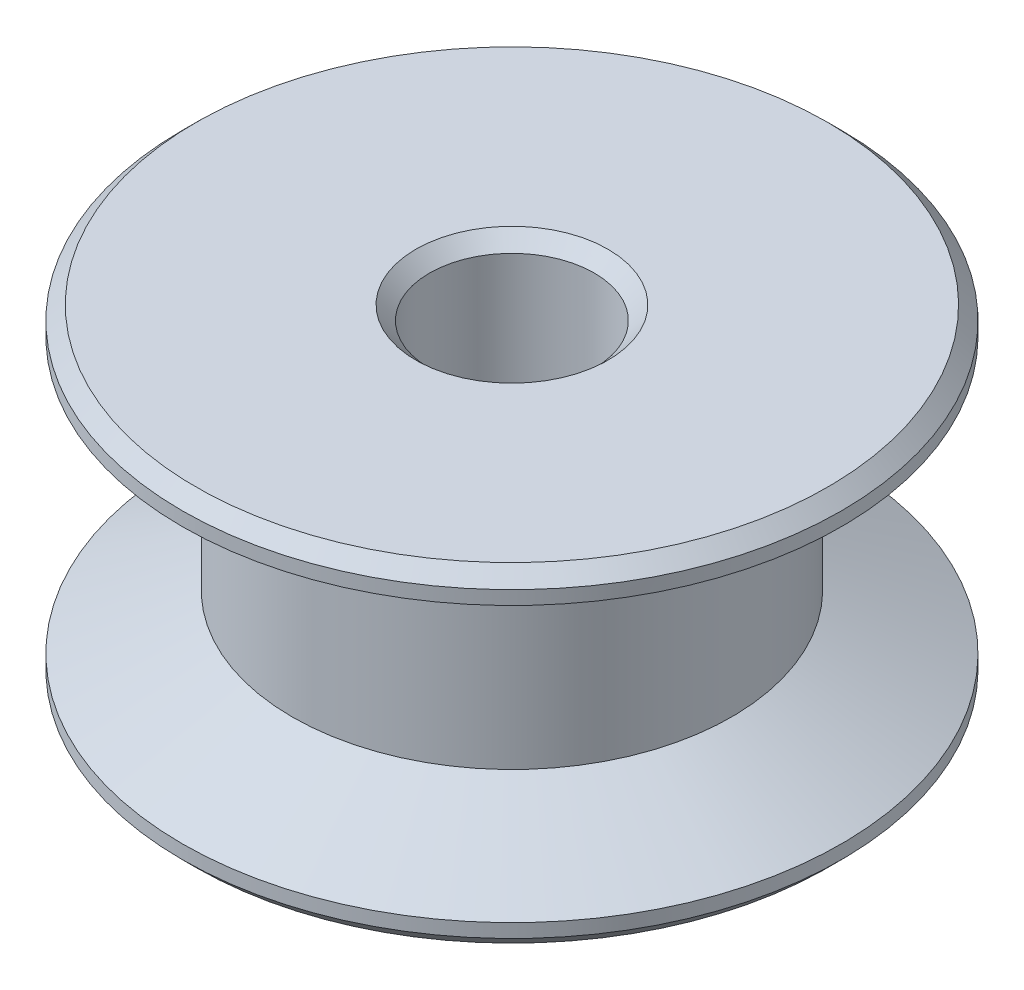
from build123d import *

# Parameters (mm, degrees)
CUT_EXTRUDE1_DEPTH      = 17.497783942
CUT_EXTRUDE1_DEPTH_BACK = 17.497783942
SKETCH2_R               = 2.38125
CHAMFER1_SIZE           = 0.396875


with BuildPart() as part:
    # Sketch1 → Revolve1 (revolve)
    with BuildSketch(Plane.XY):
        Polygon((0, 0), (9.525, 0), (9.525, 0.79375), (6.35, 2.38125), (6.35, 7.14375), (9.525, 8.73125), (9.525, 9.525), (0, 9.525), align=None)
    revolve(axis=Axis((0, 9.525, 0), (0, -1, 0)))

    # Sketch2 → Cut-Extrude1 (cut, two sides: drawn at the far end of the back side and taken through both)
    with BuildSketch(Plane(origin=(0, 9.525, 0), x_dir=(1, 0, 0), z_dir=(0, 1, 0)).offset(-CUT_EXTRUDE1_DEPTH_BACK)):
        Circle(SKETCH2_R)
    extrude(amount=CUT_EXTRUDE1_DEPTH + CUT_EXTRUDE1_DEPTH_BACK, mode=Mode.SUBTRACT)

    # Chamfer1
    chamfer1_edges = [part.edges().sort_by_distance(p)[0] for p in [
        (-9.525, 0, 0),
        (-2.38125, 0, 0),
        (-9.525, 9.525, 0),
        (-2.38125, 9.525, 0),
    ]]
    chamfer(chamfer1_edges, length=CHAMFER1_SIZE)


solid = part.part
